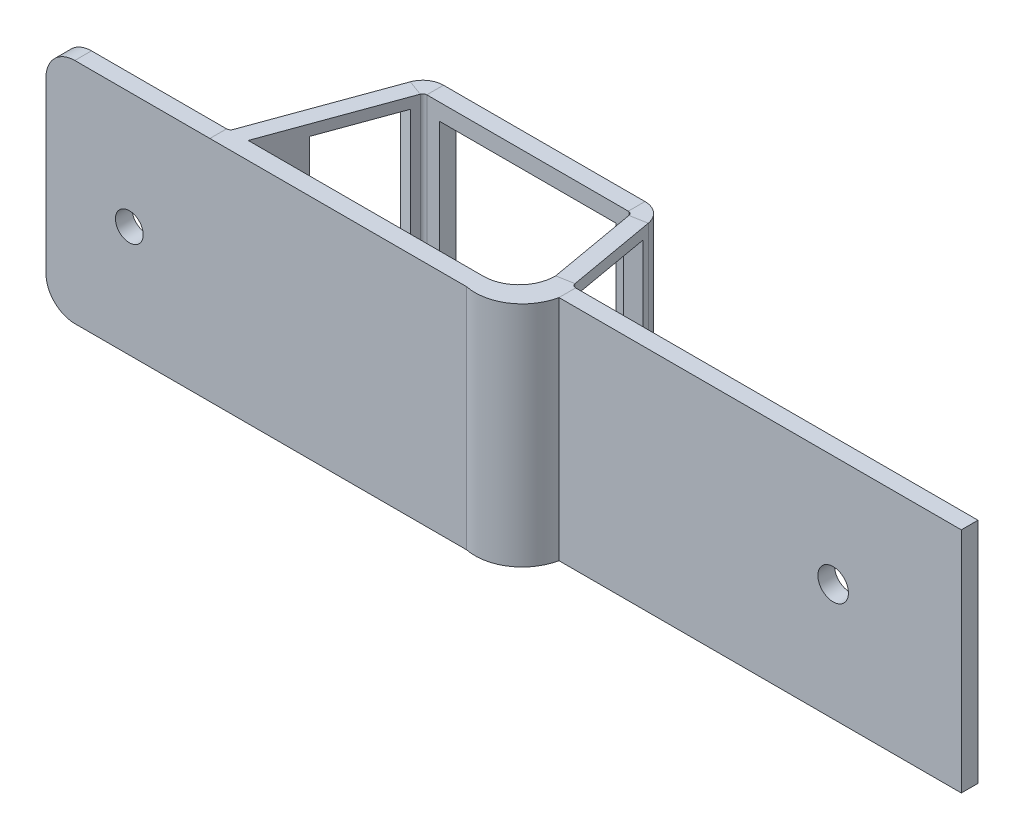
from build123d import *

# Parameters (mm, degrees)
BASE_FLANGE1_DEPTH  = 41
SKETCH2_R           = 2.5
CUT_EXTRUDE1_DEPTH  = 10
SKETCH3_R           = 2.75
SKETCH3_R_2         = 2.5
CUT_EXTRUDE2_DEPTH  = 10
BOSS_EXTRUDE1_START = -41
BOSS_EXTRUDE1_DEPTH = 41
SKETCH5_W           = 31.746142427
SKETCH5_H           = 33.611284957
CUT_EXTRUDE3_DEPTH  = 19
CUT_EXTRUDE4_START  = 2.688066512
CUT_EXTRUDE4_DEPTH  = 36.36668128
CUT_EXTRUDE5_DEPTH  = 3


# Read off the part's stored shape, not the designer's step: Cut-Extrude4, Cut-Extrude5
# Sheet-metal steps are written as plain solids
with BuildPart() as part:
    # Sketch1 → Base-Flange1 (new body)
    with BuildSketch(Plane(origin=(0, 0, 0), x_dir=(1, 0, 0), z_dir=(0, 1, 0))):
        with BuildLine():
            Line((0, 0), (29.484227127, 0))
            ThreePointArc((29.484227127, 0), (29.90672353, 0.133212604), (30.176404712, 0.484667962))
            Line((30.176404712, 0.484667962), (38.681704054, 23.85278585))
            ThreePointArc((38.681704054, 23.85278585), (40.049733788, 25.635636911), (42.1929595, 26.311393382))
            Line((42.1929595, 26.311393382), (78.441184331, 26.311393382))
            ThreePointArc((78.441184331, 26.311393382), (80.843024514, 25.437195048), (82.121016981, 23.223647163))
            Line((82.121016981, 23.223647163), (84.942198964, 7.223929074))
            ThreePointArc((84.942198964, 7.223929074), (85.194131001, 6.787569985), (85.667608355, 6.615238322))
            Line((85.667608355, 6.615238322), (158.049527566, 6.615238322))
            Line((158.049527566, 6.615238322), (158.049527566, 3.615238322))
            Line((158.049527566, 3.615238322), (85.667608355, 3.615238322))
            ThreePointArc((85.667608355, 3.615238322), (83.265768172, 4.489436656), (81.987775705, 6.702984541))
            Line((81.987775705, 6.702984541), (79.166593722, 22.70270263))
            ThreePointArc((79.166593722, 22.70270263), (78.914661685, 23.139061719), (78.441184331, 23.311393382))
            Line((78.441184331, 23.311393382), (42.1929595, 23.311393382))
            ThreePointArc((42.1929595, 23.311393382), (41.770463097, 23.178180778), (41.500781916, 22.82672542))
            Line((41.500781916, 22.82672542), (32.995482574, -0.541392468))
            ThreePointArc((32.995482574, -0.541392468), (31.627452839, -2.324243529), (29.484227127, -3))
            Line((29.484227127, -3), (0, -3))
            Line((0, -3), (0, 0))
        make_face()
    extrude(amount=BASE_FLANGE1_DEPTH)

    # Sketch2 → Cut-Extrude1 (cut)
    with BuildSketch(Plane.XY.offset(3)):
        with Locations((14.991664351, 20)):
            Circle(SKETCH2_R)
    extrude(amount=-CUT_EXTRUDE1_DEPTH, mode=Mode.SUBTRACT)

    # Sketch3 → Cut-Extrude2 (cut)
    with BuildSketch(Plane.XY.offset(-3.615238322)):
        with Locations((134.991664351, 21)):
            Circle(SKETCH3_R)
        with Locations((14.991664351, 20)):
            Circle(SKETCH3_R_2)
    extrude(amount=-CUT_EXTRUDE2_DEPTH, mode=Mode.SUBTRACT)

    # Sketch4 → Boss-Extrude1 (add)
    with BuildSketch(Plane(origin=(0, 41, 0), x_dir=(1, 0, 0), z_dir=(0, 1, 0)).offset(BOSS_EXTRUDE1_START)):
        with BuildLine():
            Line((29.484227127, -3), (75.654085032, -3))
            ThreePointArc((75.654085032, -3), (82.030907409, -1.766249423), (85.667608355, 3.615238322))
            ThreePointArc((85.667608355, 3.615238322), (83.265768172, 4.489436656), (81.987775705, 6.702984541))
            ThreePointArc((81.987775705, 6.702984541), (80.181574687, 2.106348284), (75.654085032, 0.133212604))
            Line((75.654085032, 0.133212604), (29.90672353, 0.133212604))
            Line((29.90672353, 0.133212604), (29.484227127, -3))
        make_face()
    extrude(amount=BOSS_EXTRUDE1_DEPTH)

    # Sketch5 → Cut-Extrude3 (cut)
    with BuildSketch(Plane.XY.offset(-23.311393382)):
        with Locations((60.358708807, 21.215436548)):
            Rectangle(SKETCH5_W, SKETCH5_H)
    extrude(amount=-CUT_EXTRUDE3_DEPTH, mode=Mode.SUBTRACT)

    # Cut-Extrude4 outline → Cut-Extrude4 (cut)
    with BuildSketch(Plane(origin=(0, 0, 0), x_dir=(1, 0, 0), z_dir=(0, 1, 0)).offset(CUT_EXTRUDE4_START)):
        Polygon((79.368642173, 21.556828923), (81.806889388, 7.728841823), (84.761312647, 8.249786356), (82.323065432, 22.077773456), align=None)
        Polygon((38.219499528, 22.582889353), (33.376132128, 9.275846786), (36.19520999, 8.249786356), (41.038577391, 21.556828923), align=None)
    extrude(amount=CUT_EXTRUDE4_DEPTH, mode=Mode.SUBTRACT)

    # Cut-Extrude5 outline → Cut-Extrude5 (cut)
    with BuildSketch(Plane.XY):
        with BuildLine():
            Line((0, 41), (0, 35.818729295))
            ThreePointArc((0, 35.818729295), (1.526422616, 39.473577384), (5.181270705, 41))
            Line((5.181270705, 41), (0, 41))
        make_face()
        with BuildLine():
            ThreePointArc((5.188265578, 0), (1.627560559, 1.417661865), (0, 4.887450335))
            Line((0, 4.887450335), (0, 0))
            Line((0, 0), (5.188265578, 0))
        make_face()
    extrude(amount=CUT_EXTRUDE5_DEPTH, mode=Mode.SUBTRACT)


solid = part.part
